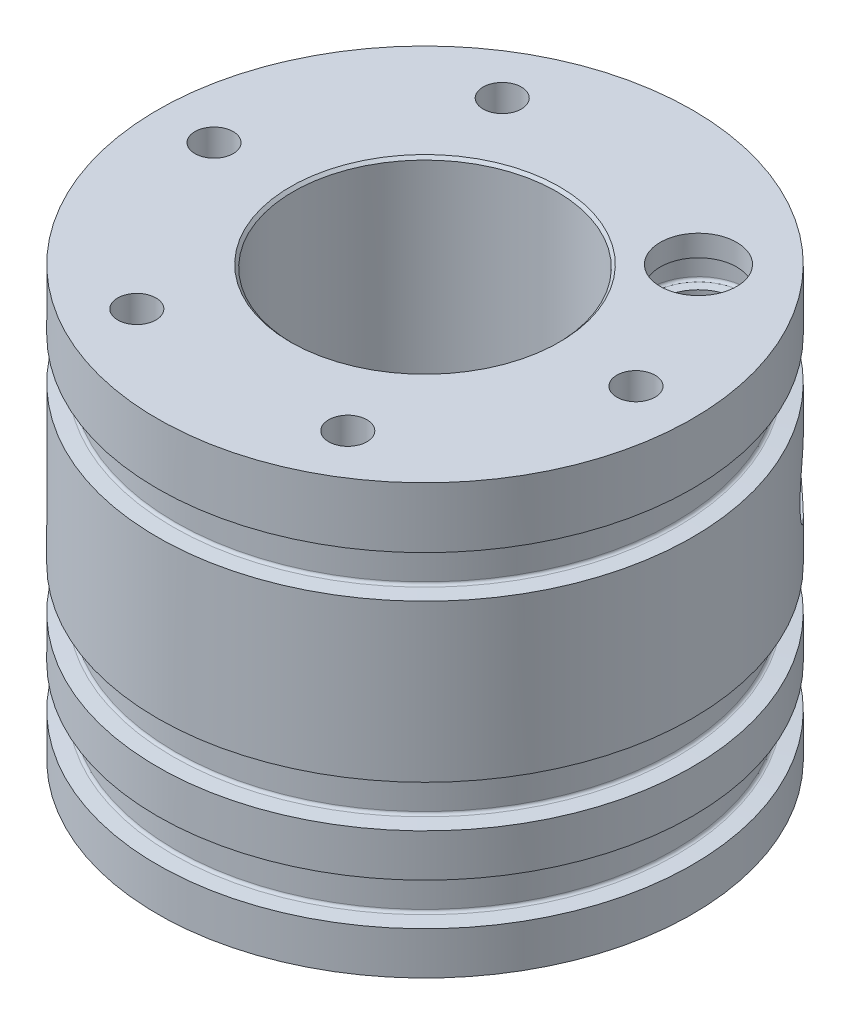
from build123d import *

# Parameters (mm, degrees)
CIRPATTERN1_COUNT            = 6
CUT_EXTRUDE1_REACH           = 72.009
CUT_EXTRUDE1_END_RADIUS      = 11.8999
SKETCH15_R                   = 3.175
F_5_16_24_TAPPED_HOLE1_D     = 6.9088
F_5_16_24_TAPPED_HOLE1_DEPTH = 16.509
F_5_16_24_TAPPED_HOLE1_TIP   = 2.075612922
CHAMFER1_SIZE                = 0.254


with BuildPart() as part:
    # Sketch1 → Revolve1 (revolve)
    with BuildSketch(Plane.XY):
        Polygon((6.8961, 0), (6.8961, 3.81), (11.8999, 10.956166996), (11.8999, 38.735), (24.1554, 38.735), (24.1554, 0), align=None)
    revolve(axis=Axis((0, 0, 0), (0, 1, 0)))

    # Sketch6 → Groove for AS 568-132, O-Ring2 (revolve, cut)
    with BuildSketch(Plane(origin=(0, 0, 0), x_dir=(0, 0, -1), z_dir=(-1, 0, 0))):
        with BuildLine():
            Line((22.774362441, -3.977491583), (24.6888, -3.81))
            Line((24.6888, -3.81), (24.6888, -7.700983167))
            Line((24.6888, -7.700983167), (22.774362441, -7.533491583))
            ThreePointArc((22.774362441, -7.533491583), (22.609231556, -7.452058043), (22.5425, -7.28045813))
            Line((22.5425, -7.28045813), (22.5425, -4.230525037))
            ThreePointArc((22.5425, -4.230525037), (22.609231556, -4.058925124), (22.774362441, -3.977491583))
        make_face()
    revolve(axis=Axis((0, -50, 0), (0, 1, 0)), mode=Mode.SUBTRACT)

    # Sketch4 → Groove for AS 568-132, O-Ring1 (revolve, cut)
    with BuildSketch(Plane(origin=(0, 0, 0), x_dir=(0, 0, -1), z_dir=(-1, 0, 0))):
        with BuildLine():
            Line((22.774362441, -11.631808297), (24.6888, -11.464316714))
            Line((24.6888, -11.464316714), (24.6888, -15.355299881))
            Line((24.6888, -15.355299881), (22.774362441, -15.187808297))
            ThreePointArc((22.774362441, -15.187808297), (22.609231556, -15.106374757), (22.5425, -14.934774844))
            Line((22.5425, -14.934774844), (22.5425, -11.88484175))
            ThreePointArc((22.5425, -11.88484175), (22.609231556, -11.713241838), (22.774362441, -11.631808297))
        make_face()
    revolve(axis=Axis((0, -50, 0), (0, 1, 0)), mode=Mode.SUBTRACT)

    # Sketch9 → #8-32 Tapped Hole1 (revolve, cut)
    with BuildSketch(Plane(origin=(19.05, 38.735, 0), x_dir=(0, 0, 1), z_dir=(1, 0, 0))):
        Polygon((0, 0), (0, 10.562806461), (1.7272, 9.525), (1.7272, 0), align=None)
    f_8_32_tapped_hole1 = revolve(axis=Axis((19.05, 45.085, 0), (0, -1, 0)), mode=Mode.SUBTRACT)

    # CirPattern1: #8-32 Tapped Hole1 ×6 about axis, 1 skipped
    cirpattern1_axis = Axis((0, 0, 0), (0, -1, 0))
    add([f_8_32_tapped_hole1.rotate(cirpattern1_axis, i * 360 / CIRPATTERN1_COUNT) for i in range(1, CIRPATTERN1_COUNT) if i not in (5,)], mode=Mode.SUBTRACT)

    # Sketch11 → Groove for AS 568-132, O-Ring3 (revolve, cut)
    with BuildSketch(Plane(origin=(0, 0, 0), x_dir=(0, 0, -1), z_dir=(-1, 0, 0))):
        with BuildLine():
            Line((22.774362441, -29.592156785), (24.6888, -29.424665202))
            Line((24.6888, -29.424665202), (24.6888, -33.315648369))
            Line((24.6888, -33.315648369), (22.774362441, -33.148156785))
            ThreePointArc((22.774362441, -33.148156785), (22.609231556, -33.066723245), (22.5425, -32.895123332))
            Line((22.5425, -32.895123332), (22.5425, -29.845190239))
            ThreePointArc((22.5425, -29.845190239), (22.609231556, -29.673590326), (22.774362441, -29.592156785))
        make_face()
    revolve(axis=Axis((0, -50, 0), (0, 1, 0)), mode=Mode.SUBTRACT)

    # Cut-Extrude1: up to this cylinder (the profile starts outside it)
    cut_extrude1_end = Plane(origin=(0, 22.225, 0), z_dir=(0, -1, 0)) * Cylinder(CUT_EXTRUDE1_END_RADIUS, 168.8178, mode=Mode.PRIVATE)
    # Sketch15 → Cut-Extrude1 (cut, up to the surface)
    with BuildSketch(Plane(origin=(17.080447142, 0, -17.080447142), x_dir=(0, -1, 0), z_dir=(0.7071067811865488, 0, -0.7071067811865464)), mode=Mode.PRIVATE) as cut_extrude1_sk1:
        with Locations((-22.225, 0)):
            Circle(SKETCH15_R)
    cut_extrude1_tool1 = extrude(cut_extrude1_sk1.sketch, amount=-CUT_EXTRUDE1_REACH, mode=Mode.PRIVATE) - cut_extrude1_end
    add(cut_extrude1_tool1.solids().sort_by_distance((17.080447, 22.225, -17.080447))[0], mode=Mode.SUBTRACT)

    # 5/16-24 Tapped Hole1
    with Locations(Plane(origin=(0, 38.735, 0), x_dir=(1, 0, 0), z_dir=(0, 1, 0))):
        with Locations((12.347852166, 12.347852166)):
            Hole(F_5_16_24_TAPPED_HOLE1_D / 2, depth=F_5_16_24_TAPPED_HOLE1_DEPTH)
            with Locations((0, 0, -(F_5_16_24_TAPPED_HOLE1_DEPTH + F_5_16_24_TAPPED_HOLE1_TIP / 2))):  # 118° drill point
                Cone(0, F_5_16_24_TAPPED_HOLE1_D / 2, F_5_16_24_TAPPED_HOLE1_TIP, mode=Mode.SUBTRACT)

    # Chamfer1
    chamfer1_edges = [part.edges().sort_by_distance(p)[0] for p in [
        (-11.8999, 38.735, 0),
    ]]
    chamfer(chamfer1_edges, length=CHAMFER1_SIZE)

    # Sketch17 → Groove for AS 568-010, O-Ring1 (revolve, cut)
    with BuildSketch(Plane(origin=(12.347852166, 38.735, -12.347852166), x_dir=(0, 0, 1), z_dir=(-1, 0, 0))):
        with BuildLine():
            Line((4.213137559, -1.9939), (3.0861, -1.89529699))
            Line((3.0861, -1.89529699), (3.0861, -4.45470301))
            Line((3.0861, -4.45470301), (4.213137559, -4.3561))
            ThreePointArc((4.213137559, -4.3561), (4.378268444, -4.274666459), (4.445, -4.103066547))
            Line((4.445, -4.103066547), (4.445, -2.246933453))
            ThreePointArc((4.445, -2.246933453), (4.378268444, -2.075333541), (4.213137559, -1.9939))
        make_face()
    revolve(axis=Axis((12.347852166, 88.735, -12.347852166), (0, -1, 0)), mode=Mode.SUBTRACT)

    # Sketch19 → Groove for AS 568-010, O-Ring2 (revolve, cut)
    with BuildSketch(Plane(origin=(12.347852166, 38.735, -12.347852166), x_dir=(0, 0, 1), z_dir=(-1, 0, 0))):
        with BuildLine():
            Line((4.213137559, -10.2489), (3.0861, -10.15029699))
            Line((3.0861, -10.15029699), (3.0861, -12.70970301))
            Line((3.0861, -12.70970301), (4.213137559, -12.6111))
            ThreePointArc((4.213137559, -12.6111), (4.378268444, -12.529666459), (4.445, -12.358066547))
            Line((4.445, -12.358066547), (4.445, -10.501933453))
            ThreePointArc((4.445, -10.501933453), (4.378268444, -10.330333541), (4.213137559, -10.2489))
        make_face()
    revolve(axis=Axis((12.347852166, 88.735, -12.347852166), (0, -1, 0)), mode=Mode.SUBTRACT)


solid = part.part
